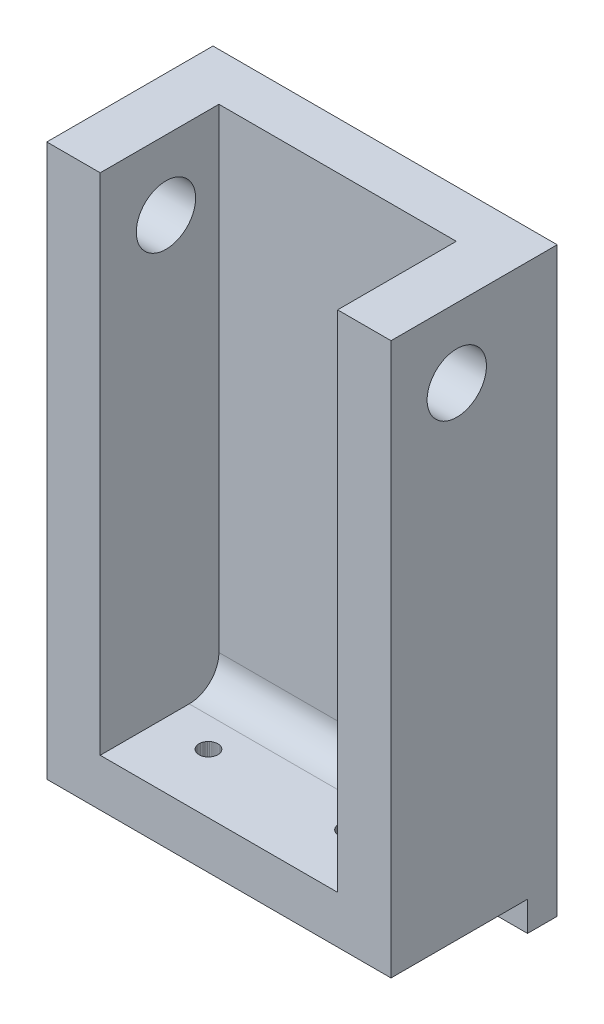
from build123d import *

# Parameters (mm, degrees)
SKETCH1_W           = 57.999999262
SKETCH1_H           = 28.000000864
BOSS_EXTRUDE1_DEPTH = 8
CUT_EXTRUDE10_REACH = 59.565
SKETCH11_R          = 1.6
CUT_EXTRUDE11_DEPTH = 58.565336436
CUT_EXTRUDE12_DEPTH = 58.565336436
SKETCH15_W          = 5.000000121
SKETCH15_H          = 4.999999888
BOSS_EXTRUDE2_DEPTH = 4.999998957
SKETCH16_W          = 4.999998957
SKETCH16_H          = 4.999999888
BOSS_EXTRUDE3_DEPTH = 4.999998957
BOSS_EXTRUDE4_DEPTH = 85
HOLE2_START         = -8.343500085
HOLE2_OUTLINE_R     = 5
HOLE2_DEPTH         = 57.999999262
FILLET1_R           = 5


# Read off the part's stored shape, not the designer's step: Hole2
with BuildPart() as part:
    # Sketch1 → Boss-Extrude1 (new body)
    with BuildSketch(Plane.XZ):
        with Locations((20.656499546, 14.000000432)):
            Rectangle(SKETCH1_W, SKETCH1_H)
    extrude(amount=BOSS_EXTRUDE1_DEPTH)

    # Sketch11 → Cut-Extrude10 (cut, up to next)
    with BuildSketch(Plane.XZ.offset(8), mode=Mode.PRIVATE) as cut_extrude10_sk1:
        with Locations(Location((20.656499132, 2.749998098, 0), (0, 0, 270))):
            Circle(SKETCH11_R)
    cut_extrude10_tool1 = extrude(cut_extrude10_sk1.sketch, amount=-CUT_EXTRUDE10_REACH, mode=Mode.PRIVATE) & part.part
    add(cut_extrude10_tool1.solids().sort_by_distance((20.656499, -8, 2.749998))[0], mode=Mode.SUBTRACT)

    # Sketch12 → Cut-Extrude11 (cut, through all)
    with BuildSketch(Plane(origin=(0, -8, 0), x_dir=(-1, 0, 0), z_dir=(0, 1, 0))):
        Polygon((-7.388492115, 18.547229469), (-7.506358903, 18.799999729), (-7.666328922, 19.028460607), (-7.863540202, 19.225670025), (-8.092000149, 19.385639578), (-8.344767615, 19.503509626), (-8.614162914, 19.575690851), (-8.891999722, 19.600000232), (-9.16983746, 19.575690851), (-9.439231828, 19.503509626), (-9.692000225, 19.385639578), (-9.920460172, 19.225670025), (-10.11766959, 19.028460607), (-10.277640074, 18.799999729), (-10.395510122, 18.547229469), (-10.467690416, 18.277840689), (-10.491999798, 17.999999225), (-10.467690416, 17.722159624), (-10.395510122, 17.452770844), (-10.277640074, 17.200000584), (-10.11766959, 16.971539706), (-9.920460172, 16.774330288), (-9.692000225, 16.614360735), (-9.439231828, 16.496490687), (-9.16983746, 16.424309462), (-8.891999722, 16.40000008), (-8.614162914, 16.424309462), (-8.344767615, 16.496490687), (-8.092000149, 16.614360735), (-7.863540202, 16.774330288), (-7.666328922, 16.971539706), (-7.506358903, 17.200000584), (-7.388492115, 17.452770844), (-7.316308096, 17.722159624), (-7.292000111, 17.999999225), (-7.316308096, 18.277840689), align=None)
    extrude(amount=CUT_EXTRUDE11_DEPTH, mode=Mode.SUBTRACT)

    # Sketch13 → Cut-Extrude12 (cut, through all)
    with BuildSketch(Plane.XZ.offset(8)):
        Polygon((32.698839903, 16.424309462), (32.968230546, 16.496490687), (33.220998943, 16.614360735), (33.449459821, 16.774330288), (33.646669239, 16.971539706), (33.806640655, 17.200000584), (33.92450884, 17.452770844), (33.996690065, 17.722159624), (34.021001309, 17.999999225), (33.996690065, 18.277840689), (33.92450884, 18.547229469), (33.806640655, 18.799999729), (33.646669239, 19.028460607), (33.449459821, 19.225670025), (33.220998943, 19.385639578), (32.968230546, 19.503509626), (32.698839903, 19.575690851), (32.421000302, 19.600000232), (32.143160701, 19.575690851), (31.873770058, 19.503509626), (31.621001661, 19.385639578), (31.392540783, 19.225670025), (31.195329502, 19.028460607), (31.035359949, 18.799999729), (30.917489901, 18.547229469), (30.845310539, 18.277840689), (30.820999295, 17.999999225), (30.845310539, 17.722159624), (30.917489901, 17.452770844), (31.035359949, 17.200000584), (31.195329502, 16.971539706), (31.392540783, 16.774330288), (31.621001661, 16.614360735), (31.873770058, 16.496490687), (32.143160701, 16.424309462), (32.421000302, 16.40000008), align=None)
    extrude(amount=-CUT_EXTRUDE12_DEPTH, mode=Mode.SUBTRACT)

    # Sketch15 → Boss-Extrude2 (add)
    with BuildSketch(Plane.XZ.offset(8)):
        with Locations((-5.843500025, 2.499999944)):
            Rectangle(SKETCH15_W, SKETCH15_H)
    extrude(amount=BOSS_EXTRUDE2_DEPTH)

    # Sketch16 → Boss-Extrude3 (add)
    with BuildSketch(Plane.XZ.offset(8)):
        with Locations((47.156499698, 2.499999944)):
            Rectangle(SKETCH16_W, SKETCH16_H)
    extrude(amount=BOSS_EXTRUDE3_DEPTH)

    # Sketch17 → Boss-Extrude4 (add)
    with BuildSketch(Plane(origin=(0, 0, 0), x_dir=(1, 0, 0), z_dir=(0, 1, 0))):
        Polygon((-8.343500085, 0), (49.656499177, 0), (49.656499177, -8), (49.656499177, -28.000000864), (40.656499177, -28.000000864), (40.656499177, -8), (0.656499915, -8), (0.656499915, -28.000000864), (-8.343500085, -28.000000864), (-8.343500085, -8), align=None)
    extrude(amount=BOSS_EXTRUDE4_DEPTH)

    # Hole2 outline → Hole2 (cut)
    with BuildSketch(Plane.YZ.offset(HOLE2_START)):
        with Locations((73.288734932, 16.920895282)):
            Circle(HOLE2_OUTLINE_R)
    extrude(amount=HOLE2_DEPTH, mode=Mode.SUBTRACT)

    # Fillet1
    fillet1_edges = [part.edges().sort_by_distance(p)[0] for p in [
        (20.656499546, 0, 8),
    ]]
    fillet(fillet1_edges, radius=FILLET1_R)


solid = part.part
